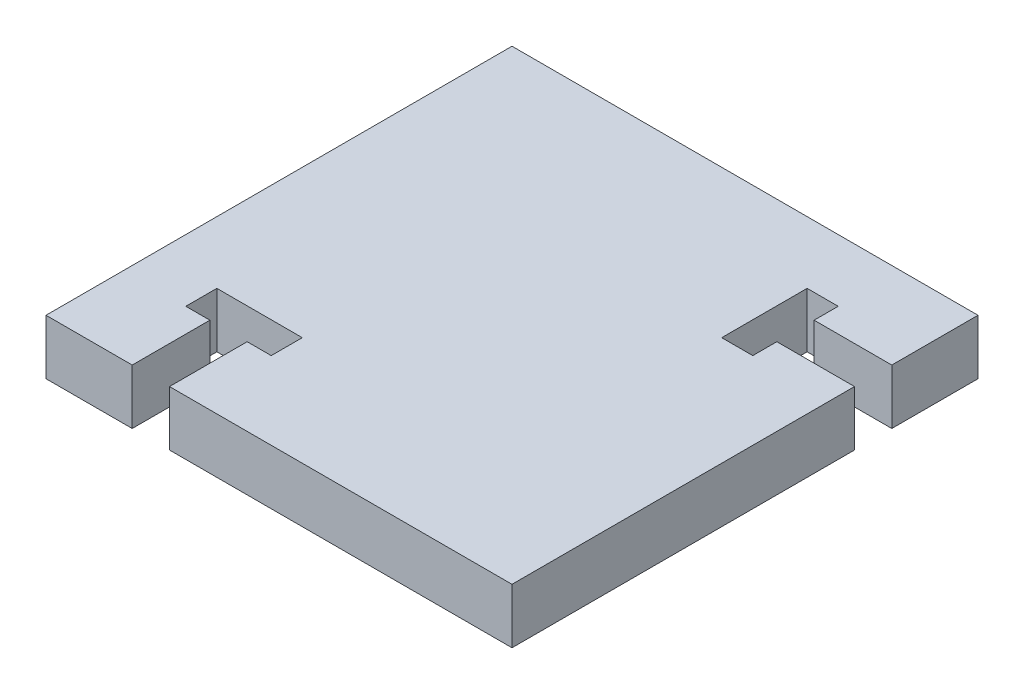
from build123d import *

# Parameters (mm, degrees)
BOSS_EXTRUDE1_DEPTH = 4.4958


with BuildPart() as part:
    # Sketch1 → Boss-Extrude1 (new body)
    with BuildSketch(Plane(origin=(0, 0, 0), x_dir=(1, 0, 0), z_dir=(0, 1, 0))):
        Polygon((-31.0515, 0), (-31.0515, 6.35), (-33.02, 6.35), (-33.02, 8.89), (-26.035, 8.89), (-26.035, 6.35), (-28.0035, 6.35), (-28.0035, 0), (0, 0), (0, 28.0035), (-6.35, 28.0035), (-6.35, 26.035), (-8.89, 26.035), (-8.89, 33.02), (-6.35, 33.02), (-6.35, 31.0515), (0, 31.0515), (0, 38.1), (-38.1, 38.1), (-38.1, 0), align=None)
    extrude(amount=BOSS_EXTRUDE1_DEPTH)


solid = part.part
